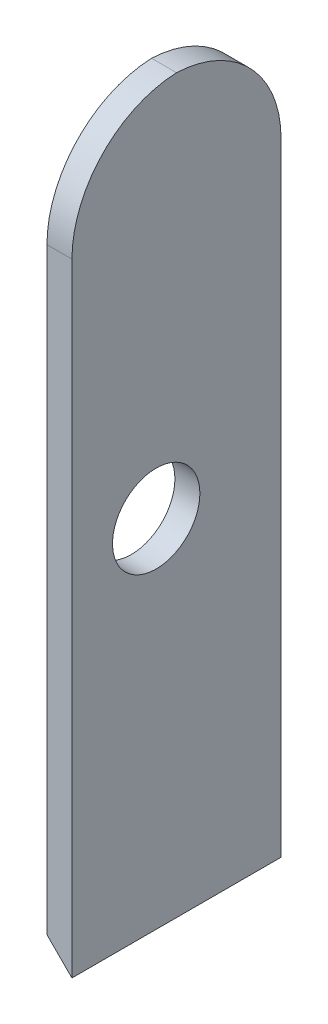
from build123d import *

# Parameters (mm, degrees)
SKETCH2_W           = 6.7
SKETCH2_H           = 23.5
BOSS_EXTRUDE2_DEPTH = 0.8
CHAMFER1_SIZE       = 0.85
FILLET2_R           = 3.5
SKETCH6_R           = 1.4
CUT_EXTRUDE1_DEPTH  = 0.8


with BuildPart() as part:
    # Sketch2 → Boss-Extrude2 (new body)
    with BuildSketch(Plane(origin=(0, 0, 0), x_dir=(0, 0, -1), z_dir=(1, 0, 0))):
        Rectangle(SKETCH2_W, SKETCH2_H)
    extrude(amount=BOSS_EXTRUDE2_DEPTH)

    # Chamfer1
    # the kernel refuses this chamfer: 0.85 mm, written as the material it takes off along each edge
    with BuildSketch(Plane(origin=(0, -11.75, -5.53593054), x_dir=(0.9996219169112968, -0.02749587661058583, 0), z_dir=(0, 0, 1))) as chamfer1_piece_1:
        Polygon((CHAMFER1_SIZE * 0.999621916911, CHAMFER1_SIZE * 0.0274958766106), (-CHAMFER1_SIZE * 0.0274958766106, CHAMFER1_SIZE * 0.999621916911), (0, 0), align=None)
    extrude(amount=11.07186108, mode=Mode.SUBTRACT)

    # Fillet2
    # the kernel refuses this fillet: 3.5 mm, written as the material it takes off along each edge
    with BuildSketch(Plane(origin=(-8.75, 11.75, -3.35), x_dir=(0, -1, 0), z_dir=(1, 0, 0)), Plane(origin=(-8.75, 11.75, 3.35), x_dir=(0, 0, -1), z_dir=(1, 0, 0))) as fillet2_piece_1:
        with BuildLine():
            CenterArc((FILLET2_R, -FILLET2_R), FILLET2_R, 90, 90)
            Line((0, -FILLET2_R), (0, 0))
            Line((0, 0), (FILLET2_R, 0))
        make_face()
    extrude(amount=18.3, mode=Mode.SUBTRACT)

    # Sketch6 → Cut-Extrude1 (cut)
    with BuildSketch(Plane(origin=(0.8, 0, 0), x_dir=(0, 0, -1), z_dir=(1, 0, 0))):
        with Locations((-0.65, -0.3)):
            Circle(SKETCH6_R)
    extrude(amount=-CUT_EXTRUDE1_DEPTH, mode=Mode.SUBTRACT)


solid = part.part
